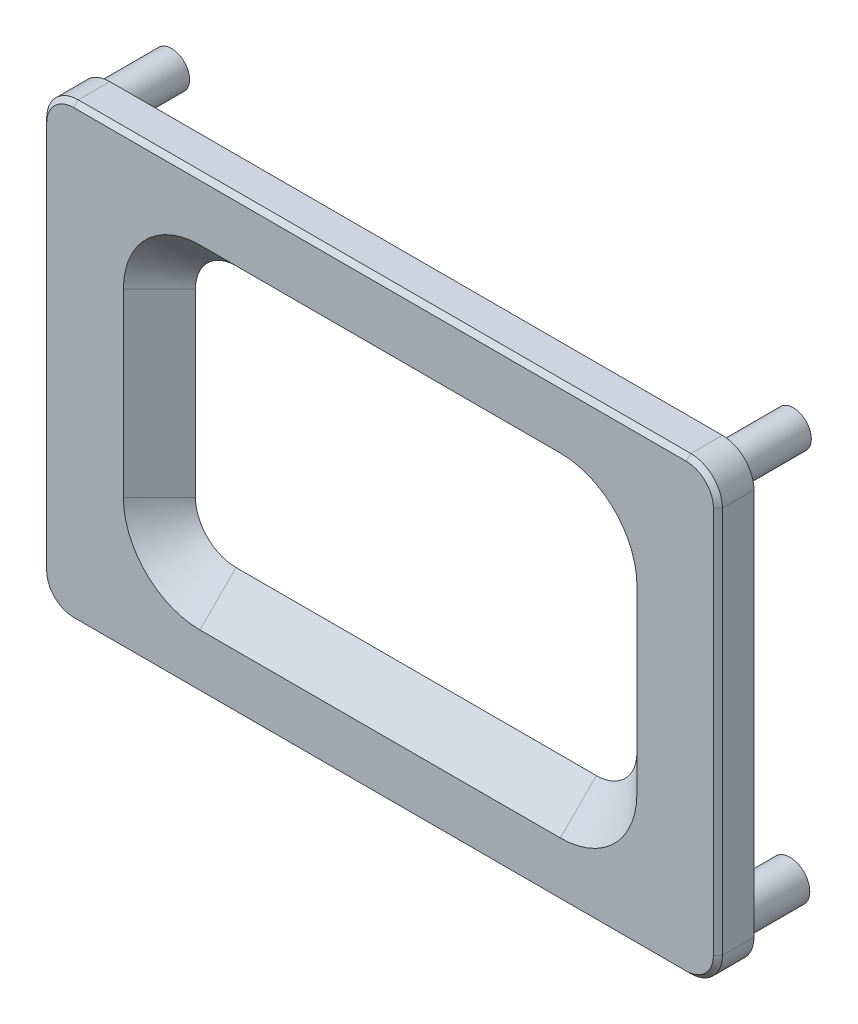
from build123d import *

# Parameters (mm, degrees)
EXTRUDE_1_DEPTH     = 8
CUT_EXTRUDE_1_DEPTH = 8
CHAMFER_2_SIZE      = 1
SKETCH_3_R          = 4
SKETCH_3_R_2        = 2
EXTRUDE_3_DEPTH     = 15
SKETCH_5_R          = 4.396393258
SKETCH_5_R_2        = 2
EXTRUDE_4_DEPTH     = 15
SKETCH_9_R          = 4
SKETCH_9_R_2        = 2
EXTRUDE_5_DEPTH     = 15
SKETCH_10_R         = 4
SKETCH_10_R_2       = 2
EXTRUDE_6_DEPTH     = 15
CHAMFER_6_SIZE      = 10


with BuildPart() as part:
    # 草图1 → 凸台-拉伸1 (new body)
    with BuildSketch(Plane.XY):
        with BuildLine():
            Line((-44.320266629, 53.264700042), (91.679733371, 53.264700042))
            ThreePointArc((91.679733371, 53.264700042), (96.629480839, 51.21444751), (98.679733371, 46.264700042))
            Line((98.679733371, 46.264700042), (98.679733371, -39.735299958))
            ThreePointArc((98.679733371, -39.735299958), (96.629480839, -44.685047426), (91.679733371, -46.735299958))
            Line((91.679733371, -46.735299958), (-44.320266629, -46.735299958))
            ThreePointArc((-44.320266629, -46.735299958), (-49.270014098, -44.685047426), (-51.320266629, -39.735299958))
            Line((-51.320266629, -39.735299958), (-51.320266629, 46.264700042))
            ThreePointArc((-51.320266629, 46.264700042), (-49.270014098, 51.21444751), (-44.320266629, 53.264700042))
        make_face()
    extrude(amount=EXTRUDE_1_DEPTH)

    # 草图2 → 切除-拉伸1 (cut)
    with BuildSketch(Plane.XY.offset(8)):
        with BuildLine():
            Line((-16.295074043, 29.864928603), (63.704925957, 29.864928603))
            ThreePointArc((63.704925957, 29.864928603), (68.654673426, 27.814676072), (70.704925957, 22.864928603))
            Line((70.704925957, 22.864928603), (70.704925957, -17.135071397))
            ThreePointArc((70.704925957, -17.135071397), (68.654673426, -22.084818865), (63.704925957, -24.135071397))
            Line((63.704925957, -24.135071397), (-16.295074043, -24.135071397))
            ThreePointArc((-16.295074043, -24.135071397), (-21.244821511, -22.084818865), (-23.295074043, -17.135071397))
            Line((-23.295074043, -17.135071397), (-23.295074043, 22.864928603))
            ThreePointArc((-23.295074043, 22.864928603), (-21.244821511, 27.814676072), (-16.295074043, 29.864928603))
        make_face()
    extrude(amount=-CUT_EXTRUDE_1_DEPTH, mode=Mode.SUBTRACT)

    # 倒角2
    chamfer_2_edges = [part.edges().sort_by_distance(p)[0] for p in [
        (96.629480839, -44.685047426, 8),
        (98.679733371, 3.264700042, 8),
        (96.629480839, 51.21444751, 8),
        (23.679733371, 53.264700042, 8),
        (-49.270014098, 51.21444751, 8),
        (-51.320266629, 3.264700042, 8),
        (-49.270014098, -44.685047426, 8),
        (23.679733371, -46.735299958, 8),
    ]]
    chamfer(chamfer_2_edges, length=CHAMFER_2_SIZE)

    # 草图3 → 凸台-拉伸3 (add)
    with BuildSketch(Plane(origin=(0, 0, 0), x_dir=(-1, 0, 0), z_dir=(0, 0, -1))):
        with Locations(Location((-92.417207429, 47.443208316, 0), (0, 0, 180))):
            Circle(SKETCH_3_R)
        with Locations((-92.417207429, 47.443208316)):
            Circle(SKETCH_3_R_2, mode=Mode.SUBTRACT)
    extrude(amount=EXTRUDE_3_DEPTH)

    # 草图5 → 凸台-拉伸4 (add)
    with BuildSketch(Plane(origin=(0, 0, 0), x_dir=(-1, 0, 0), z_dir=(0, 0, -1))):
        with Locations(Location((-91.679733371, -39.735299958, 0), (0, 0, 180))):
            Circle(SKETCH_5_R)
        with Locations((-91.679733371, -39.735299958)):
            Circle(SKETCH_5_R_2, mode=Mode.SUBTRACT)
    extrude(amount=EXTRUDE_4_DEPTH)

    # 草图9 → 凸台-拉伸5 (add)
    with BuildSketch(Plane(origin=(0, 0, 0), x_dir=(-1, 0, 0), z_dir=(0, 0, -1))):
        with Locations(Location((45.596569925, 47.500240672, 0), (0, 0, 180))):
            Circle(SKETCH_9_R)
        with Locations((45.596569925, 47.500240672)):
            Circle(SKETCH_9_R_2, mode=Mode.SUBTRACT)
    extrude(amount=EXTRUDE_5_DEPTH)

    # 草图10 → 凸台-拉伸6 (add)
    with BuildSketch(Plane(origin=(0, 0, 0), x_dir=(-1, 0, 0), z_dir=(0, 0, -1))):
        with Locations(Location((42.719793233, -38.535931412, 0), (0, 0, 180))):
            Circle(SKETCH_10_R)
        with Locations((42.719793233, -38.535931412)):
            Circle(SKETCH_10_R_2, mode=Mode.SUBTRACT)
    extrude(amount=EXTRUDE_6_DEPTH)

    # 倒角6
    # the kernel refuses this chamfer: 10 mm, written as the material it takes off along each edge
    with BuildSketch(Plane(origin=(63.704925957, -24.135071397, 8), x_dir=(0, -0.9996219169112968, 0.027495876610586317), z_dir=(-1, 0, 0)), Plane(origin=(-16.295074043, 29.864928603, 8), x_dir=(0, 0.9996219169112968, 0.027495876610586317), z_dir=(1, 0, 0))) as chamfer_6_piece_1:
        Polygon((CHAMFER_6_SIZE * 0.999621916911, -CHAMFER_6_SIZE * 0.0274958766106), (-CHAMFER_6_SIZE * 0.0274958766106, -CHAMFER_6_SIZE * 0.999621916911), (0, 0), align=None)
    extrude(amount=80, mode=Mode.SUBTRACT)
    with BuildSketch(Plane(origin=(63.704925957, -17.135071397, 8), x_dir=(1, 0, 0), z_dir=(0, 1, 0))) as chamfer_6_piece_2:
        Polygon((7 + CHAMFER_6_SIZE, 0), (7, CHAMFER_6_SIZE), (7, 0), align=None)
    revolve(axis=Axis((63.704925957, -17.135071397, 8), (0, 0, -1)), revolution_arc=90, mode=Mode.SUBTRACT)
    with BuildSketch(Plane(origin=(70.704925957, 22.864928603, 8), x_dir=(0.9996219169112968, 0, 0.027495876610586317), z_dir=(0, -1, 0)), Plane(origin=(-23.295074043, -17.135071397, 8), x_dir=(-0.9996219169112968, 0, 0.02749587661058631), z_dir=(0, 1, 0))) as chamfer_6_piece_3:
        Polygon((CHAMFER_6_SIZE * 0.999621916911, -CHAMFER_6_SIZE * 0.0274958766106), (-CHAMFER_6_SIZE * 0.0274958766106, -CHAMFER_6_SIZE * 0.999621916911), (0, 0), align=None)
    extrude(amount=40, mode=Mode.SUBTRACT)
    with BuildSketch(Plane(origin=(63.704925957, 22.864928603, 8), x_dir=(0, 1, 0), z_dir=(-1, 0, 0))) as chamfer_6_piece_4:
        Polygon((7 + CHAMFER_6_SIZE, 0), (7, CHAMFER_6_SIZE), (7, 0), align=None)
    revolve(axis=Axis((63.704925957, 22.864928603, 8), (0, 0, -1)), revolution_arc=90, mode=Mode.SUBTRACT)
    with BuildSketch(Plane(origin=(-16.295074043, -17.135071397, 8), x_dir=(0, -1, 0), z_dir=(1, 0, 0))) as chamfer_6_piece_5:
        Polygon((7 + CHAMFER_6_SIZE, 0), (7, CHAMFER_6_SIZE), (7, 0), align=None)
    revolve(axis=Axis((-16.295074043, -17.135071397, 8), (0, 0, -1)), revolution_arc=90, mode=Mode.SUBTRACT)
    with BuildSketch(Plane(origin=(-16.295074043, 22.864928603, 8), x_dir=(-1, 0, 0), z_dir=(0, -1, 0))) as chamfer_6_piece_6:
        Polygon((7 + CHAMFER_6_SIZE, 0), (7, CHAMFER_6_SIZE), (7, 0), align=None)
    revolve(axis=Axis((-16.295074043, 22.864928603, 8), (0, 0, -1)), revolution_arc=90, mode=Mode.SUBTRACT)


solid = part.part
